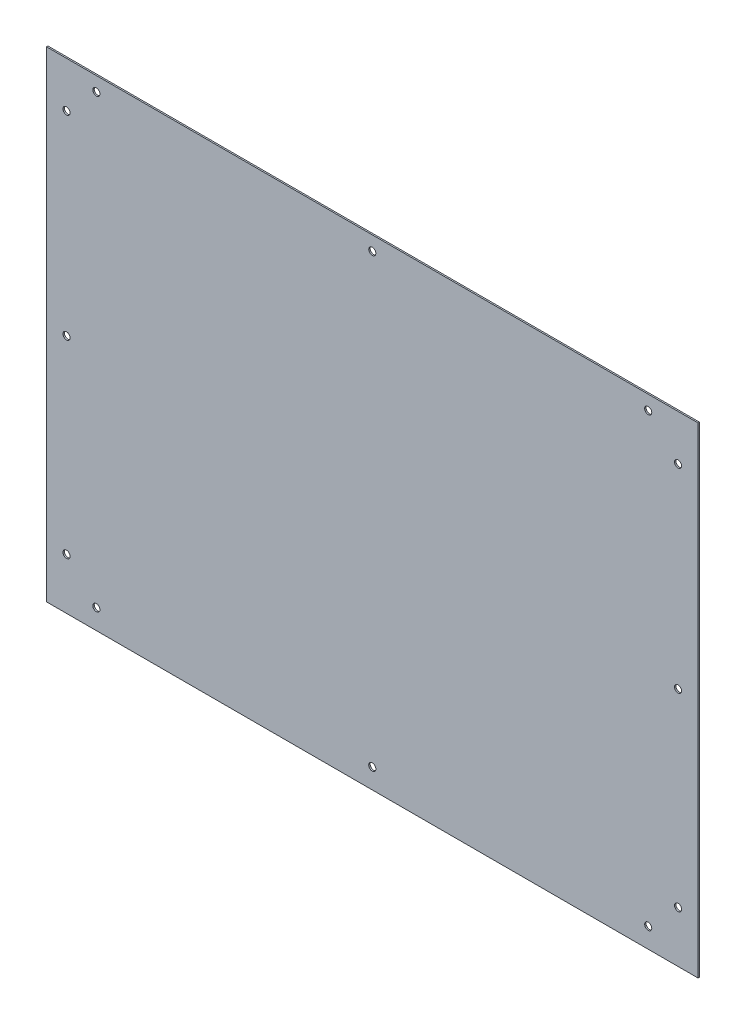
from build123d import *

# Parameters (mm, degrees)
SKETCH1_W           = 458
SKETCH1_H           = 338
BOSS_EXTRUDE1_DEPTH = 1
SKETCH2_R           = 2.5
CUT_EXTRUDE1_DEPTH  = 285.610259829


with BuildPart() as part:
    # Sketch1 → Boss-Extrude1 (new body)
    with BuildSketch(Plane.XY):
        Rectangle(SKETCH1_W, SKETCH1_H)
    extrude(amount=BOSS_EXTRUDE1_DEPTH)

    # Sketch2 → Cut-Extrude1 (cut, through all)
    with BuildSketch(Plane.XY.offset(1)):
        with Locations((-194, 159)):
            Circle(SKETCH2_R)
        with Locations((-194, -155)):
            Circle(SKETCH2_R)
        with Locations((194, -155)):
            Circle(SKETCH2_R)
        with Locations((194, 159)):
            Circle(SKETCH2_R)
        with Locations((-215, 0)):
            Circle(SKETCH2_R)
        with Locations((-215, -133)):
            Circle(SKETCH2_R)
        with Locations((-215, 137)):
            Circle(SKETCH2_R)
        with Locations((215, 0)):
            Circle(SKETCH2_R)
        with Locations((215, -133)):
            Circle(SKETCH2_R)
        with Locations((215, 137)):
            Circle(SKETCH2_R)
        with Locations((0, 159)):
            Circle(SKETCH2_R)
        with Locations((0, -155)):
            Circle(SKETCH2_R)
    extrude(amount=-CUT_EXTRUDE1_DEPTH, mode=Mode.SUBTRACT)


solid = part.part
